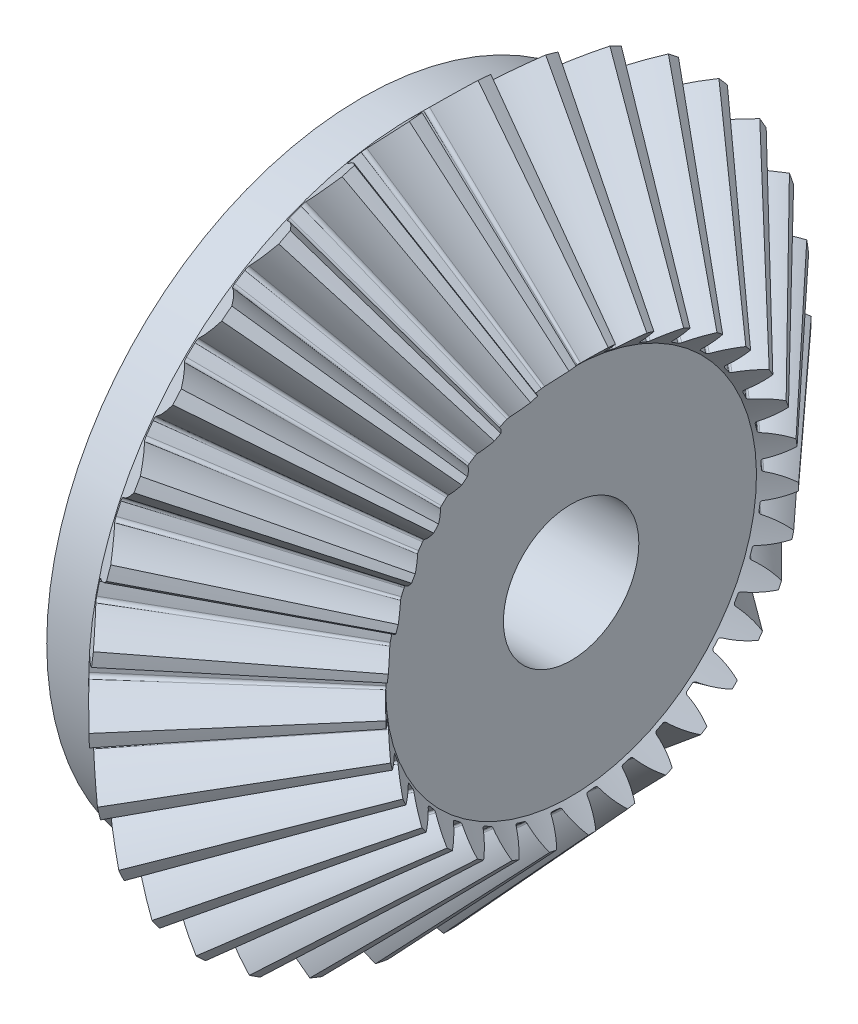
from build123d import *

# Parameters (mm, degrees)
TEETHCUTS_COUNT         = 33
TEETHCUTS_ANGLE         = 349.090909091
HUBSKE_R                = 15
HUB_DEPTH               = 2.449164146
BORSKE_R                = 5
BORE_DEPTH              = 20.0000508
CORTAR_EXTRUIR1_DEPTH   = 4.5
CROQUIS2_R              = 6.062177826
CROQUIS2_R_2            = 3.225
SALIENTE_EXTRUIR1_DEPTH = 10


with BuildPart() as part:
    # BasProSke → Base-Revolve (revolve)
    with BuildSketch(Plane(origin=(0, 0, 0), x_dir=(1, 0, 0), z_dir=(0, 1, 0)), mode=Mode.PRIVATE) as base_revolve_sk:
        Polygon((0, 0), (0, 15.449062547), (1.758044236, 17.207106781), (8.526081738, 9.833008659), (7.521446594, 8.828373517), (7.521446594, 0), align=None)
    revolve(base_revolve_sk.sketch.rotate(Axis((-10, 0, 0), (1, 0, 0)), 180), axis=Axis((-10, 0, 0), (1, 0, 0)))

    # ToothCut: read off the stored shape, not the designer's step
    # ToothCut: loft between two sections, ruled curve by curve
    toothcut_from = [
        Edge.make_bspline([(17.557371624, 0.006434169, -0.008859602), (17.552987386, 0.002049932, -0.015227606), (17.546735772, -0.004201682, -0.014317002), (17.543361398, -0.007576056, -0.006818885)], [0, 0, 0, 0, 1, 1, 1, 1], 3, [1, 0.74701913, 0.74701913, 1]),
        Edge.make_bspline([(17.543361398, -0.007576056, 0.006818885), (17.546735772, -0.004201682, 0.014317002), (17.552987386, 0.002049932, 0.015227606), (17.557371624, 0.006434169, 0.008859602)], [0, 0, 0, 0, 1, 1, 1, 1], 3, [1, 0.74701913, 0.74701913, 1]),
        Edge.make_bspline([(17.543361398, -0.007576056, -0.006818885), (17.542947276, -0.007990178, -0.005898674), (17.542619935, -0.008317519, -0.004911011), (17.542384772, -0.008552683, -0.003872176)], [0, 0, 0, 0, 1, 1, 1, 1], 3, [1, 0.994505488, 0.994505488, 1]),
        Edge.make_bspline([(17.542384772, -0.008552683, 0.003872176), (17.542619935, -0.008317519, 0.004911011), (17.542947276, -0.007990178, 0.005898674), (17.543361398, -0.007576056, 0.006818885)], [0, 0, 0, 0, 1, 1, 1, 1], 3, [1, 0.994505488, 0.994505488, 1]),
        Edge.make_bspline([(17.542384772, -0.008552683, -0.003872176), (17.541809982, -0.009127473, -0.00133304), (17.541809982, -0.009127473, 0.00133304), (17.542384772, -0.008552683, 0.003872176)], [0, 0, 0, 0, 1, 1, 1, 1], 3, [1, 0.968257159, 0.968257159, 1]),
        Edge.make_line((17.557371624, 0.006434169, 0.008859602), (17.557371624, 0.006434169, -0.008859602)),
    ]
    toothcut_to = [
        Edge.make_bspline([(1.957843945, 17.406906489, -1.550186802), (1.462436883, 16.911499428, -1.039232437), (0.9062007, 16.355263246, -0.674358083), (0.310395439, 15.759457986, -0.469509697)], [0, 0, 0, 0, 1, 1, 1, 1], 3, [1, 0.987259582, 0.987259582, 1]),
        Edge.make_bspline([(0.310395439, 15.759457986, 0.469509697), (0.9062007, 16.355263246, 0.674358083), (1.462436883, 16.911499428, 1.039232437), (1.957843945, 17.406906489, 1.550186802)], [0, 0, 0, 0, 1, 1, 1, 1], 3, [1, 0.987259582, 0.987259582, 1]),
        Edge.make_bspline([(0.310395439, 15.759457986, -0.469509697), (0.246991047, 15.696053594, -0.447710146), (0.207142743, 15.65620529, -0.374637034), (0.208346141, 15.657408688, -0.28237351)], [0, 0, 0, 0, 1, 1, 1, 1], 3, [1, 0.853648189, 0.853648189, 1]),
        Edge.make_bspline([(0.208346141, 15.657408688, 0.28237351), (0.207142743, 15.65620529, 0.374637034), (0.246991047, 15.696053594, 0.447710146), (0.310395439, 15.759457986, 0.469509697)], [0, 0, 0, 0, 1, 1, 1, 1], 3, [1, 0.853648189, 0.853648189, 1]),
        Edge.make_bspline([(0.208346141, 15.657408688, -0.28237351), (0.210801344, 15.659863891, -0.094135177), (0.210801344, 15.659863891, 0.094135177), (0.208346141, 15.657408688, 0.28237351)], [0, 0, 0, 0, 1, 1, 1, 1], 3, [1, 0.999886615, 0.999886615, 1]),
        Edge.make_line((1.957843945, 17.406906489, 1.550186802), (1.957843945, 17.406906489, -1.550186802)),
    ]
    toothcut = Solid(Shell([*[Face.make_surface_from_curves(toothcut_from[k], toothcut_to[k]) for k in range(6)], Face(Wire(toothcut_from)), Face(Wire(toothcut_to))]))
    add(toothcut, mode=Mode.SUBTRACT)

    # TeethCuts: ToothCut ×33 about axis
    teethcuts_axis = Axis((-10, 0, 0), (1, 0, 0))
    for i in range(1, TEETHCUTS_COUNT):
        add(toothcut.rotate(teethcuts_axis, i * TEETHCUTS_ANGLE / (TEETHCUTS_COUNT - 1)), mode=Mode.SUBTRACT)

    # HubSke → Hub (add)
    with BuildSketch(Plane.ZY):
        with Locations(Location((0, 0, 0), (0, 0, 180))):
            Circle(HUBSKE_R)
    extrude(amount=HUB_DEPTH)

    # BorSke → Bore (cut, symmetric)
    with BuildSketch(Plane(origin=(0, 0, 0), x_dir=(0, 0, -1), z_dir=(1, 0, 0))):
        with Locations(Location((0, 0, 0), (0, 0, 180))):
            Circle(BORSKE_R)
    extrude(amount=BORE_DEPTH, both=True, mode=Mode.SUBTRACT)

    # Croquis1 → Cortar-Extruir1 (cut)
    with BuildSketch(Plane(origin=(7.521446594, 0, 0), x_dir=(0, 0, -1), z_dir=(1, 0, 0))):
        Polygon((3.031088913, 5.25), (-3.031088913, 5.25), (-6.062177826, 0), (-3.031088913, -5.25), (3.031088913, -5.25), (6.062177826, 0), align=None)
    extrude(amount=-CORTAR_EXTRUIR1_DEPTH, mode=Mode.SUBTRACT)

    # Croquis2 → Saliente-Extruir1 (add)
    with BuildSketch(Plane(origin=(7.521446594, 0, 0), x_dir=(0, 0, -1), z_dir=(1, 0, 0))):
        Circle(CROQUIS2_R)
        Circle(CROQUIS2_R_2, mode=Mode.SUBTRACT)
    extrude(amount=-SALIENTE_EXTRUIR1_DEPTH)


solid = part.part
